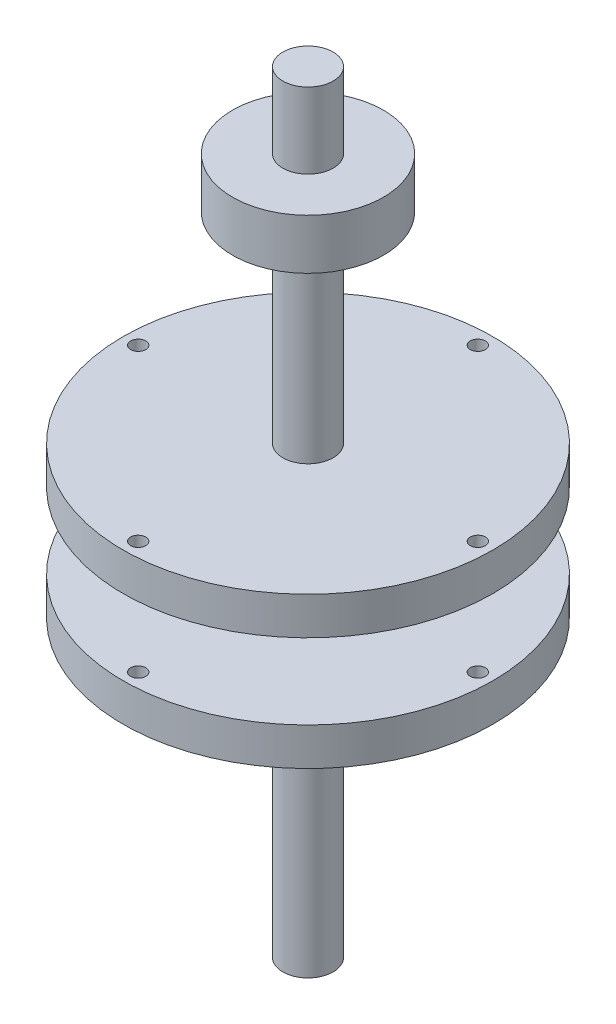
from build123d import *

# Parameters (mm, degrees)
SKETCH2_R          = 3
CUT_EXTRUDE1_DEPTH = 80


with BuildPart() as part:
    # Sketch1 → Revolve3 (revolve)
    with BuildSketch(Plane.XY):
        Polygon((0, -153.35475), (10, -153.35475), (10, -36.35475), (73.5, -36.35475), (73.5, -21.35475), (10, -21.35475), (10, 8.64525), (73.5, 8.64525), (73.5, 23.64525), (10, 23.64525), (10, 103.35475), (30, 103.35475), (30, 123.35475), (10, 123.35475), (10, 153.35475), (0, 153.35475), align=None)
    revolve(axis=Axis((0, 223.956756344, 0), (0, -1, 0)))

    # Sketch2 → Cut-Extrude1 (cut)
    with BuildSketch(Plane.XZ.offset(36.35475)):
        with Locations((67.5, 0)):
            Circle(SKETCH2_R)
        with Locations((-67.5, 0)):
            Circle(SKETCH2_R)
        with Locations((0, 67.5)):
            Circle(SKETCH2_R)
        with Locations((0, -67.5)):
            Circle(SKETCH2_R)
    extrude(amount=-CUT_EXTRUDE1_DEPTH, mode=Mode.SUBTRACT)


solid = part.part
